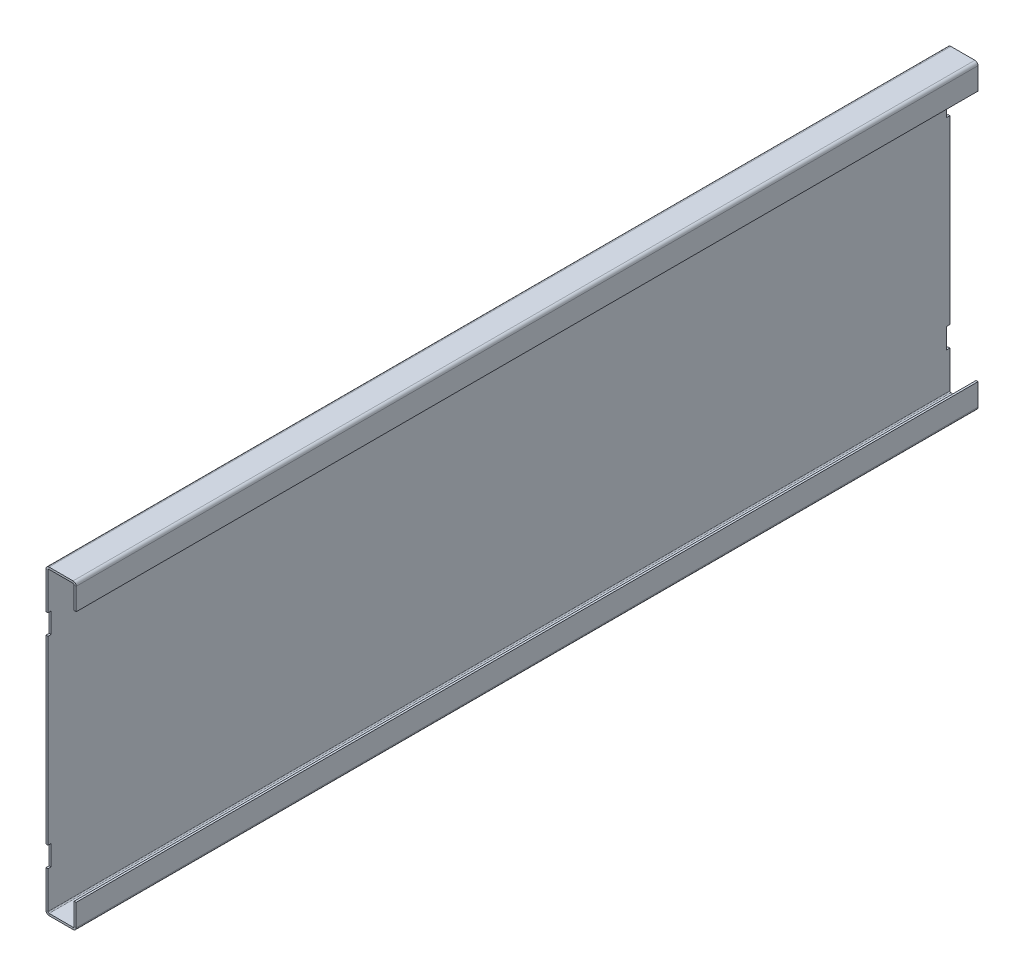
from build123d import *

# Parameters (mm, degrees)
SM_BASE_FLANGE_1_DEPTH = 896
SKETCH_4_W             = 3.1
SKETCH_4_H             = 20.2
CUT_EXTRUDE_1_DEPTH    = 10


# Sheet-metal steps are written as plain solids
with BuildPart() as part:
    # Sketch 1 → Базовая кромка1 (new body)
    with BuildSketch(Plane.XY):
        with BuildLine():
            Line((-12.578023183, 226.822978959), (-12.578023183, 248.722978959))
            ThreePointArc((-12.578023183, 248.722978959), (-13.485992161, 250.915009981), (-15.678023183, 251.822978959))
            Line((-15.678023183, 251.822978959), (-39.478023183, 251.822978959))
            ThreePointArc((-39.478023183, 251.822978959), (-41.670054205, 250.915009981), (-42.578023183, 248.722978959))
            Line((-42.578023183, 248.722978959), (-42.578023183, -45.077021041))
            ThreePointArc((-42.578023183, -45.077021041), (-41.670054205, -47.269052063), (-39.478023183, -48.177021041))
            Line((-39.478023183, -48.177021041), (-15.678023183, -48.177021041))
            ThreePointArc((-15.678023183, -48.177021041), (-13.485992161, -47.269052063), (-12.578023183, -45.077021041))
            Line((-12.578023183, -45.077021041), (-12.578023183, -23.177021041))
            Line((-12.578023183, -23.177021041), (-14.578023183, -23.177021041))
            Line((-14.578023183, -23.177021041), (-14.578023183, -45.077021041))
            ThreePointArc((-14.578023183, -45.077021041), (-14.900205724, -45.8548385), (-15.678023183, -46.177021041))
            Line((-15.678023183, -46.177021041), (-39.478023183, -46.177021041))
            ThreePointArc((-39.478023183, -46.177021041), (-40.255840642, -45.8548385), (-40.578023183, -45.077021041))
            Line((-40.578023183, -45.077021041), (-40.578023183, 248.722978959))
            ThreePointArc((-40.578023183, 248.722978959), (-40.255840642, 249.500796418), (-39.478023183, 249.822978959))
            Line((-39.478023183, 249.822978959), (-15.678023183, 249.822978959))
            ThreePointArc((-15.678023183, 249.822978959), (-14.900205724, 249.500796418), (-14.578023183, 248.722978959))
            Line((-14.578023183, 248.722978959), (-14.578023183, 226.822978959))
            Line((-14.578023183, 226.822978959), (-12.578023183, 226.822978959))
        make_face()
    extrude(amount=SM_BASE_FLANGE_1_DEPTH)

    # Эскиз4 → Вырез-Вытянуть1 (cut)
    with BuildSketch(Plane.ZY.offset(42.578023183)):
        with Locations((1.55, 201.822978959)):
            Rectangle(SKETCH_4_W, SKETCH_4_H)
        with Locations((1.55, 1.822978959)):
            Rectangle(SKETCH_4_W, SKETCH_4_H)
        with Locations((894.45, 201.822978959)):
            Rectangle(SKETCH_4_W, SKETCH_4_H)
        with Locations((894.45, 1.822978959)):
            Rectangle(SKETCH_4_W, SKETCH_4_H)
    extrude(amount=-CUT_EXTRUDE_1_DEPTH, mode=Mode.SUBTRACT)


solid = part.part
